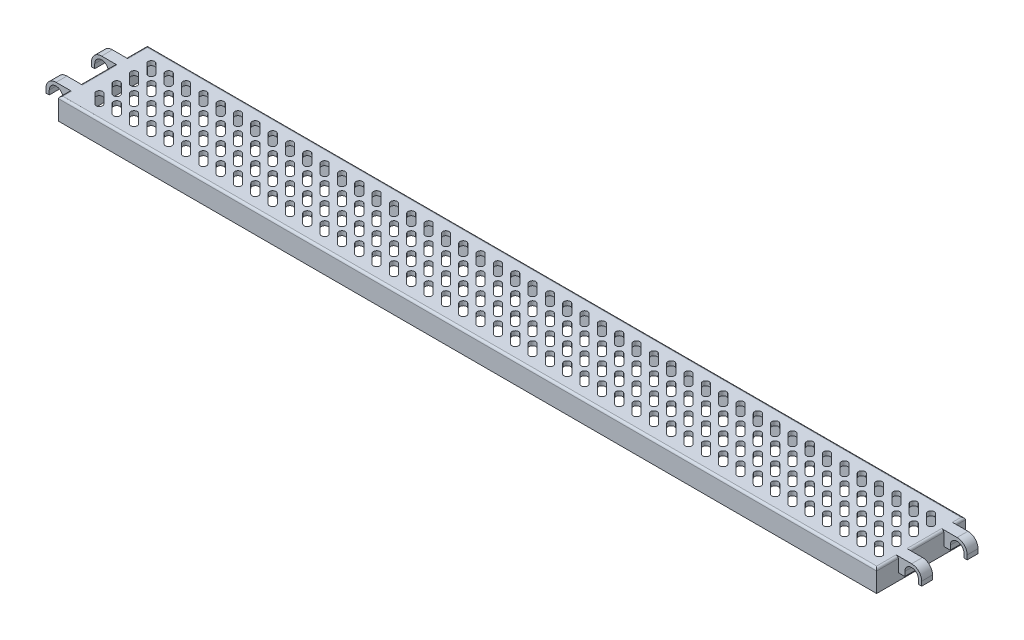
from build123d import *

# Parameters (mm, degrees)
AUFSATZ_LINEAR_AUSTRAGEN2_DEPTH = 20.5
SKIZZE3_W                       = 10.8
SKIZZE3_H                       = 5
SKIZZE3_H_2                     = 16
SKIZZE3_H_3                     = 10
SCHNITT_LINEAR_AUSTRAGEN1_DEPTH = 201.94868126
SKIZZE4_W                       = 371.7
SKIZZE4_H                       = 35
SCHNITT_LINEAR_AUSTRAGEN2_DEPTH = 8
SCHNITT_LINEAR_AUSTRAGEN3_DEPTH = 201.859086177
LINEARES_MUSTER1_COUNT          = 46
LINEARES_MUSTER1_PITCH          = 8
LINEARES_MUSTER1_COUNT_DIR2     = 4
LINEARES_MUSTER1_PITCH_DIR2     = 8
VERRUNDUNG1_R                   = 1


with BuildPart() as part:
    # Skizze1 → Aufsatz-Linear austragen2 (new, symmetric)
    with BuildSketch(Plane.XY):
        with BuildLine():
            Line((-198.15, 0), (-198.15, -2))
            Line((-198.15, -2), (-199.65, -2))
            Line((-199.65, -2), (-199.65, 0))
            ThreePointArc((-199.65, 0), (-198.288046533, 3.288046533), (-195, 4.65))
            Line((-195, 4.65), (195, 4.65))
            ThreePointArc((195, 4.65), (198.288046533, 3.288046533), (199.65, 0))
            Line((199.65, 0), (199.65, -2))
            Line((199.65, -2), (198.15, -2))
            Line((198.15, -2), (198.15, 0))
            ThreePointArc((198.15, 0), (195, 3.15), (191.85, 0))
            Line((191.85, 0), (191.85, -2))
            Line((191.85, -2), (188.85, -2))
            Line((188.85, -2), (188.85, -5.35))
            Line((188.85, -5.35), (-188.85, -5.35))
            Line((-188.85, -5.35), (-188.85, -2))
            Line((-188.85, -2), (-191.85, -2))
            Line((-191.85, -2), (-191.85, 0))
            ThreePointArc((-191.85, 0), (-195, 3.15), (-198.15, 0))
        make_face()
    extrude(amount=AUFSATZ_LINEAR_AUSTRAGEN2_DEPTH, both=True)

    # Skizze3 → Schnitt-Linear austragen1 (cut, through all)
    with BuildSketch(Plane.XZ.offset(5.35)):
        with Locations((-194.25, 18)):
            Rectangle(SKIZZE3_W, SKIZZE3_H)
        with Locations((-194.25, 2.5)):
            Rectangle(SKIZZE3_W, SKIZZE3_H_2)
        with Locations((-194.25, -15.5)):
            Rectangle(SKIZZE3_W, SKIZZE3_H_3)
        with Locations((194.25, 15.5)):
            Rectangle(SKIZZE3_W, SKIZZE3_H_3)
        with Locations((194.25, -2.5)):
            Rectangle(SKIZZE3_W, SKIZZE3_H_2)
        with Locations((194.25, -18)):
            Rectangle(SKIZZE3_W, SKIZZE3_H)
    extrude(amount=-SCHNITT_LINEAR_AUSTRAGEN1_DEPTH, mode=Mode.SUBTRACT)

    # Skizze4 → Schnitt-Linear austragen2 (cut)
    with BuildSketch(Plane.XZ.offset(5.35)):
        Rectangle(SKIZZE4_W, SKIZZE4_H)
    extrude(amount=-SCHNITT_LINEAR_AUSTRAGEN2_DEPTH, mode=Mode.SUBTRACT)

    # Skizze5 → Schnitt-Linear austragen3 (cut, through all)
    with BuildSketch(Plane.XZ.offset(-2.65)):
        with BuildLine():
            Line((-181.660660172, -13.039339828), (-177.418019485, -8.796699141))
            ThreePointArc((-177.418019485, -8.796699141), (-175.296699141, -8.796699141), (-175.296699141, -10.918019485))
            Line((-175.296699141, -10.918019485), (-179.539339828, -15.160660172))
            ThreePointArc((-179.539339828, -15.160660172), (-181.660660172, -15.160660172), (-181.660660172, -13.039339828))
        make_face()
    schnitt_linear_austragen3 = extrude(amount=-SCHNITT_LINEAR_AUSTRAGEN3_DEPTH, mode=Mode.SUBTRACT)

    # Lineares Muster1: Schnitt-Linear austragen3 46 × 4
    with Locations(*[(i * LINEARES_MUSTER1_PITCH, 0, j * LINEARES_MUSTER1_PITCH_DIR2) for i in range(LINEARES_MUSTER1_COUNT) for j in range(LINEARES_MUSTER1_COUNT_DIR2) if (i, j) != (0, 0)]):
        add(schnitt_linear_austragen3, mode=Mode.SUBTRACT)

    # Verrundung1
    verrundung1_edges = [part.edges().sort_by_distance(p)[0] for p in [
        (-188.85, 4.65, 2.5),
        (-188.85, 4.65, -15.5),
        (188.85, 4.65, 15.5),
        (188.85, 4.65, -2.5),
        (188.85, 4.65, -18),
        (-188.85, 4.65, 18),
        (0, 4.65, -20.5),
        (0, 4.65, 20.5),
    ]]
    fillet(verrundung1_edges, radius=VERRUNDUNG1_R)


solid = part.part
